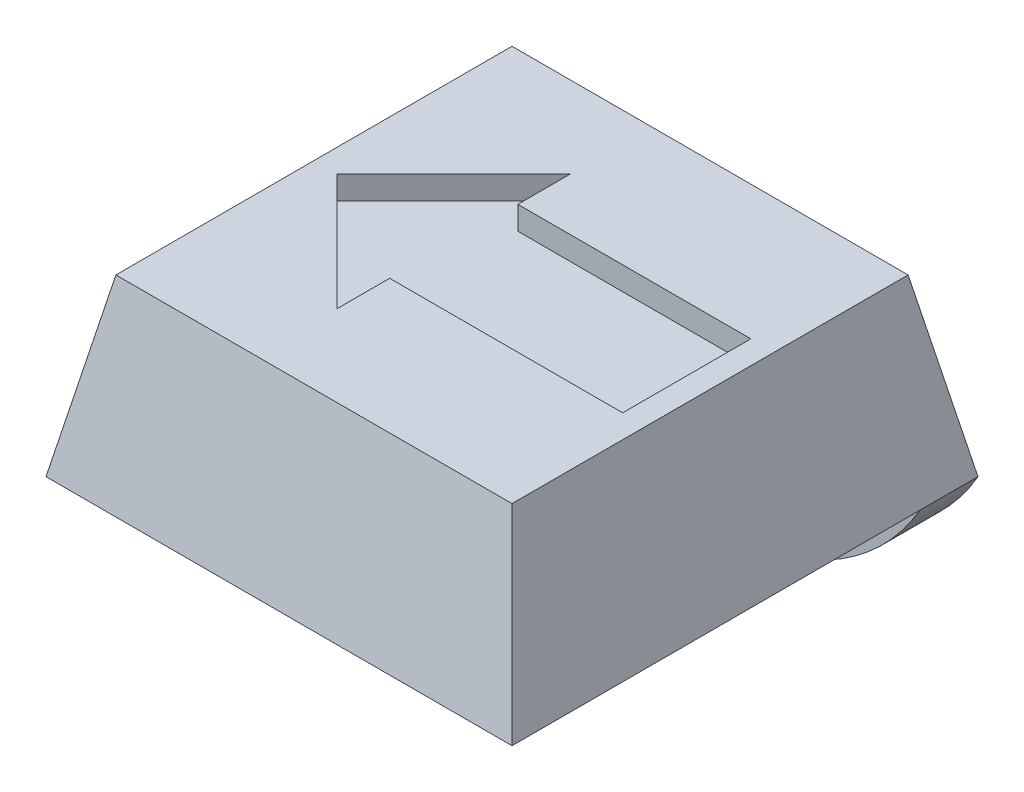
from build123d import *

# Parameters (mm, degrees)
SKETCH1_W               = 8
SKETCH1_H               = 8
BOSS_EXTRUDE1_DEPTH     = 3
CUT_EXTRUDE1_DEPTH      = 12.704699911
CUT_EXTRUDE1_DEPTH_BACK = 12.704699911
CUT_EXTRUDE2_DEPTH      = 11
SKETCH4_R               = 1.8
CUT_EXTRUDE3_DEPTH      = 0.8
SKETCH5_W               = 8
SKETCH5_H               = 1
BOSS_EXTRUDE2_DEPTH     = 2
FILLET1_R               = 4
SKETCH6_W               = 4
SKETCH6_H               = 2.2
CUT_EXTRUDE4_DEPTH      = 0.4


with BuildPart() as part:
    # Sketch1 → Boss-Extrude1 (new body)
    with BuildSketch(Plane(origin=(0, 0, 0), x_dir=(1, 0, 0), z_dir=(0, 1, 0))):
        with Locations((4, 4)):
            Rectangle(SKETCH1_W, SKETCH1_H)
    extrude(amount=BOSS_EXTRUDE1_DEPTH)

    # Sketch2 → Cut-Extrude1 (cut, two sides: drawn at the far end of the back side and taken through both)
    with BuildSketch(Plane.XY.offset(-CUT_EXTRUDE1_DEPTH_BACK)):
        Polygon((0, 0), (0.6, 3), (0, 3), align=None)
        Polygon((8, 0), (7.4, 3), (8, 3), align=None)
    extrude(amount=CUT_EXTRUDE1_DEPTH + CUT_EXTRUDE1_DEPTH_BACK, mode=Mode.SUBTRACT)

    # Sketch3 → Cut-Extrude2 (cut)
    with BuildSketch(Plane(origin=(0, 0, 0), x_dir=(0, 0, -1), z_dir=(1, 0, 0))):
        Polygon((0, 0), (0.6, 3), (0, 3), align=None)
        Polygon((8, 3), (7.4, 3), (8, 0), align=None)
    extrude(amount=CUT_EXTRUDE2_DEPTH, mode=Mode.SUBTRACT)

    # Sketch4 → Cut-Extrude3 (cut)
    with BuildSketch(Plane.XZ):
        with Locations(Location((4, -3.75, 0), (0, 0, 270))):
            Circle(SKETCH4_R)
    extrude(amount=-CUT_EXTRUDE3_DEPTH, mode=Mode.SUBTRACT)

    # Sketch5 → Boss-Extrude2 (add)
    with BuildSketch(Plane.XZ):
        with Locations((4, -7.5)):
            Rectangle(SKETCH5_W, SKETCH5_H)
    extrude(amount=BOSS_EXTRUDE2_DEPTH)

    # Fillet1
    # the kernel refuses this fillet: 4 mm, written as the material it takes off along each edge
    with BuildSketch(Plane(origin=(8, -2, -16.660254038), x_dir=(0, 1, 0), z_dir=(0, 0, 1)), Plane(origin=(0, -2, 1.660254038), x_dir=(0, 1, 0), z_dir=(0, 0, -1))) as fillet1_piece_1:
        with BuildLine():
            CenterArc((4, 3.464101615), FILLET1_R, 180, 60)
            Line((0, 3.464101615), (-0.08, 3.464101615))
            Line((-0.08, 3.464101615), (-0.08, 0))
            Line((-0.08, 0), (0, -0.08))
            ThreePointArc((0, -0.08), (1, -0.08), (1.96, -0.069282032))
            Line((1.96, -0.069282032), (2, 0))
        make_face()
    extrude(amount=18.320508076, mode=Mode.SUBTRACT)

    # Sketch6 → Cut-Extrude4 (cut)
    with BuildSketch(Plane(origin=(0, 3, 0), x_dir=(1, 0, 0), z_dir=(0, 1, 0))):
        Polygon((1, 4), (3, 2), (3, 2.9), (3, 5.1), (3, 6), align=None)
        with Locations((5, 4)):
            Rectangle(SKETCH6_W, SKETCH6_H)
    extrude(amount=-CUT_EXTRUDE4_DEPTH, mode=Mode.SUBTRACT)


solid = part.part
